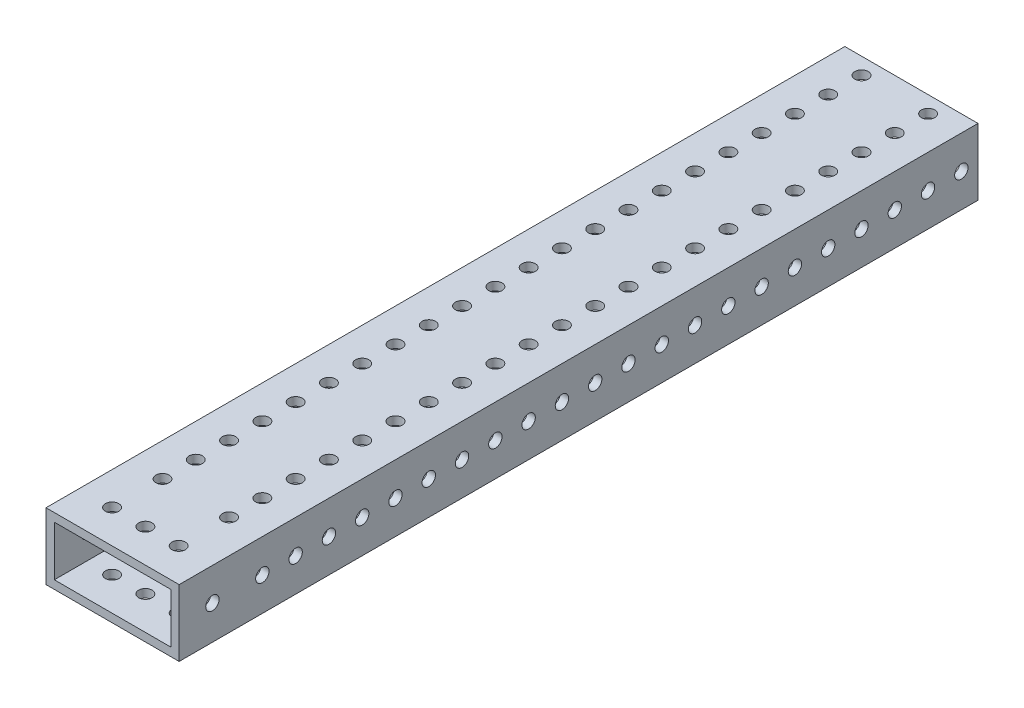
from build123d import *

# Parameters (mm, degrees)
SKETCH1_W           = 50.8
SKETCH1_H           = 304.8
BOSS_EXTRUDE1_DEPTH = 25.4
SKETCH2_W           = 44.45
SKETCH2_H           = 19.05
CUT_EXTRUDE1_DEPTH  = 311.04651264
SKETCH4_R           = 2.5527
CUT_EXTRUDE2_DEPTH  = 311.04651264
SKETCH5_R           = 2.5527
CUT_EXTRUDE3_DEPTH  = 311.04651264


with BuildPart() as part:
    # Sketch1 → Boss-Extrude1 (new body)
    with BuildSketch(Plane(origin=(0, 0, 0), x_dir=(1, 0, 0), z_dir=(0, 1, 0))):
        with Locations((25.4, 152.4)):
            Rectangle(SKETCH1_W, SKETCH1_H)
    extrude(amount=BOSS_EXTRUDE1_DEPTH)

    # Sketch2 → Cut-Extrude1 (cut, through all)
    with BuildSketch(Plane.XY):
        with Locations((25.4, 12.7)):
            Rectangle(SKETCH2_W, SKETCH2_H)
    extrude(amount=-CUT_EXTRUDE1_DEPTH, mode=Mode.SUBTRACT)

    # Sketch4 → Cut-Extrude2 (cut, through all)
    with BuildSketch(Plane(origin=(0, 25.4, 0), x_dir=(1, 0, 0), z_dir=(0, 1, 0))):
        with Locations((12.7, 31.75)):
            Circle(SKETCH4_R)
        with Locations((38.1, 31.75)):
            Circle(SKETCH4_R)
        with Locations((12.7, 44.45)):
            Circle(SKETCH4_R)
        with Locations((38.1, 44.45)):
            Circle(SKETCH4_R)
        with Locations((12.7, 57.15)):
            Circle(SKETCH4_R)
        with Locations((38.1, 57.15)):
            Circle(SKETCH4_R)
        with Locations((12.7, 69.85)):
            Circle(SKETCH4_R)
        with Locations((38.1, 69.85)):
            Circle(SKETCH4_R)
        with Locations((12.7, 82.55)):
            Circle(SKETCH4_R)
        with Locations((38.1, 82.55)):
            Circle(SKETCH4_R)
        with Locations((12.7, 95.25)):
            Circle(SKETCH4_R)
        with Locations((38.1, 95.25)):
            Circle(SKETCH4_R)
        with Locations((12.7, 107.95)):
            Circle(SKETCH4_R)
        with Locations((38.1, 107.95)):
            Circle(SKETCH4_R)
        with Locations((12.7, 120.65)):
            Circle(SKETCH4_R)
        with Locations((38.1, 120.65)):
            Circle(SKETCH4_R)
        with Locations((12.7, 133.35)):
            Circle(SKETCH4_R)
        with Locations((38.1, 133.35)):
            Circle(SKETCH4_R)
        with Locations((12.7, 146.05)):
            Circle(SKETCH4_R)
        with Locations((38.1, 146.05)):
            Circle(SKETCH4_R)
        with Locations((12.7, 158.75)):
            Circle(SKETCH4_R)
        with Locations((38.1, 158.75)):
            Circle(SKETCH4_R)
        with Locations((12.7, 171.45)):
            Circle(SKETCH4_R)
        with Locations((38.1, 171.45)):
            Circle(SKETCH4_R)
        with Locations((12.7, 184.15)):
            Circle(SKETCH4_R)
        with Locations((38.1, 184.15)):
            Circle(SKETCH4_R)
        with Locations((12.7, 196.85)):
            Circle(SKETCH4_R)
        with Locations((38.1, 196.85)):
            Circle(SKETCH4_R)
        with Locations((12.7, 209.55)):
            Circle(SKETCH4_R)
        with Locations((38.1, 209.55)):
            Circle(SKETCH4_R)
        with Locations((12.7, 222.25)):
            Circle(SKETCH4_R)
        with Locations((38.1, 222.25)):
            Circle(SKETCH4_R)
        with Locations((12.7, 234.95)):
            Circle(SKETCH4_R)
        with Locations((38.1, 234.95)):
            Circle(SKETCH4_R)
        with Locations((12.7, 247.65)):
            Circle(SKETCH4_R)
        with Locations((38.1, 247.65)):
            Circle(SKETCH4_R)
        with Locations((12.7, 260.35)):
            Circle(SKETCH4_R)
        with Locations((38.1, 260.35)):
            Circle(SKETCH4_R)
        with Locations((12.7, 273.05)):
            Circle(SKETCH4_R)
        with Locations((38.1, 273.05)):
            Circle(SKETCH4_R)
        with Locations((12.7, 285.75)):
            Circle(SKETCH4_R)
        with Locations((38.1, 285.75)):
            Circle(SKETCH4_R)
        with Locations((12.7, 298.45)):
            Circle(SKETCH4_R)
        with Locations((38.1, 298.45)):
            Circle(SKETCH4_R)
        with Locations((12.7, 311.15)):
            Circle(SKETCH4_R)
        with Locations((38.1, 311.15)):
            Circle(SKETCH4_R)
        with Locations((12.7, 323.85)):
            Circle(SKETCH4_R)
        with Locations((38.1, 323.85)):
            Circle(SKETCH4_R)
        with Locations((12.7, 336.55)):
            Circle(SKETCH4_R)
        with Locations((38.1, 336.55)):
            Circle(SKETCH4_R)
        with Locations((12.7, 349.25)):
            Circle(SKETCH4_R)
        with Locations((38.1, 349.25)):
            Circle(SKETCH4_R)
        with Locations((12.7, 361.95)):
            Circle(SKETCH4_R)
        with Locations((38.1, 361.95)):
            Circle(SKETCH4_R)
        with Locations((12.7, 374.65)):
            Circle(SKETCH4_R)
        with Locations((38.1, 374.65)):
            Circle(SKETCH4_R)
        with Locations((12.7, 387.35)):
            Circle(SKETCH4_R)
        with Locations((38.1, 387.35)):
            Circle(SKETCH4_R)
        with Locations((12.7, 400.05)):
            Circle(SKETCH4_R)
        with Locations((38.1, 400.05)):
            Circle(SKETCH4_R)
        with Locations((12.7, 412.75)):
            Circle(SKETCH4_R)
        with Locations((38.1, 412.75)):
            Circle(SKETCH4_R)
        with Locations((12.7, 425.45)):
            Circle(SKETCH4_R)
        with Locations((38.1, 425.45)):
            Circle(SKETCH4_R)
        with Locations((12.7, 438.15)):
            Circle(SKETCH4_R)
        with Locations((38.1, 438.15)):
            Circle(SKETCH4_R)
        with Locations((12.7, 450.85)):
            Circle(SKETCH4_R)
        with Locations((38.1, 450.85)):
            Circle(SKETCH4_R)
        with Locations((12.7, 463.55)):
            Circle(SKETCH4_R)
        with Locations((38.1, 463.55)):
            Circle(SKETCH4_R)
        with Locations((12.7, 476.25)):
            Circle(SKETCH4_R)
        with Locations((38.1, 476.25)):
            Circle(SKETCH4_R)
        with Locations((12.7, 488.95)):
            Circle(SKETCH4_R)
        with Locations((38.1, 488.95)):
            Circle(SKETCH4_R)
        with Locations((12.7, 501.65)):
            Circle(SKETCH4_R)
        with Locations((38.1, 501.65)):
            Circle(SKETCH4_R)
        with Locations((12.5095, 12.7)):
            Circle(SKETCH4_R)
        with Locations((25.2095, 12.7)):
            Circle(SKETCH4_R)
        with Locations((37.9095, 12.7)):
            Circle(SKETCH4_R)
    extrude(amount=-CUT_EXTRUDE2_DEPTH, mode=Mode.SUBTRACT)

    # Sketch5 → Cut-Extrude3 (cut, through all)
    with BuildSketch(Plane.ZY):
        with Locations((-31.75, 12.7)):
            Circle(SKETCH5_R)
        with Locations((-44.45, 12.7)):
            Circle(SKETCH5_R)
        with Locations((-57.15, 12.7)):
            Circle(SKETCH5_R)
        with Locations((-69.85, 12.7)):
            Circle(SKETCH5_R)
        with Locations((-82.55, 12.7)):
            Circle(SKETCH5_R)
        with Locations((-95.25, 12.7)):
            Circle(SKETCH5_R)
        with Locations((-107.95, 12.7)):
            Circle(SKETCH5_R)
        with Locations((-120.65, 12.7)):
            Circle(SKETCH5_R)
        with Locations((-133.35, 12.7)):
            Circle(SKETCH5_R)
        with Locations((-146.05, 12.7)):
            Circle(SKETCH5_R)
        with Locations((-158.75, 12.7)):
            Circle(SKETCH5_R)
        with Locations((-171.45, 12.7)):
            Circle(SKETCH5_R)
        with Locations((-184.15, 12.7)):
            Circle(SKETCH5_R)
        with Locations((-196.85, 12.7)):
            Circle(SKETCH5_R)
        with Locations((-209.55, 12.7)):
            Circle(SKETCH5_R)
        with Locations((-222.25, 12.7)):
            Circle(SKETCH5_R)
        with Locations((-234.95, 12.7)):
            Circle(SKETCH5_R)
        with Locations((-247.65, 12.7)):
            Circle(SKETCH5_R)
        with Locations((-260.35, 12.7)):
            Circle(SKETCH5_R)
        with Locations((-273.05, 12.7)):
            Circle(SKETCH5_R)
        with Locations((-285.75, 12.7)):
            Circle(SKETCH5_R)
        with Locations((-298.45, 12.7)):
            Circle(SKETCH5_R)
        with Locations((-311.15, 12.7)):
            Circle(SKETCH5_R)
        with Locations((-323.85, 12.7)):
            Circle(SKETCH5_R)
        with Locations((-336.55, 12.7)):
            Circle(SKETCH5_R)
        with Locations((-349.25, 12.7)):
            Circle(SKETCH5_R)
        with Locations((-361.95, 12.7)):
            Circle(SKETCH5_R)
        with Locations((-374.65, 12.7)):
            Circle(SKETCH5_R)
        with Locations((-387.35, 12.7)):
            Circle(SKETCH5_R)
        with Locations((-400.05, 12.7)):
            Circle(SKETCH5_R)
        with Locations((-412.75, 12.7)):
            Circle(SKETCH5_R)
        with Locations((-425.45, 12.7)):
            Circle(SKETCH5_R)
        with Locations((-438.15, 12.7)):
            Circle(SKETCH5_R)
        with Locations((-450.85, 12.7)):
            Circle(SKETCH5_R)
        with Locations((-463.55, 12.7)):
            Circle(SKETCH5_R)
        with Locations((-476.25, 12.7)):
            Circle(SKETCH5_R)
        with Locations((-488.95, 12.7)):
            Circle(SKETCH5_R)
        with Locations((-501.65, 12.7)):
            Circle(SKETCH5_R)
        with Locations((-12.7, 12.954)):
            Circle(SKETCH5_R)
    extrude(amount=-CUT_EXTRUDE3_DEPTH, mode=Mode.SUBTRACT)


solid = part.part
